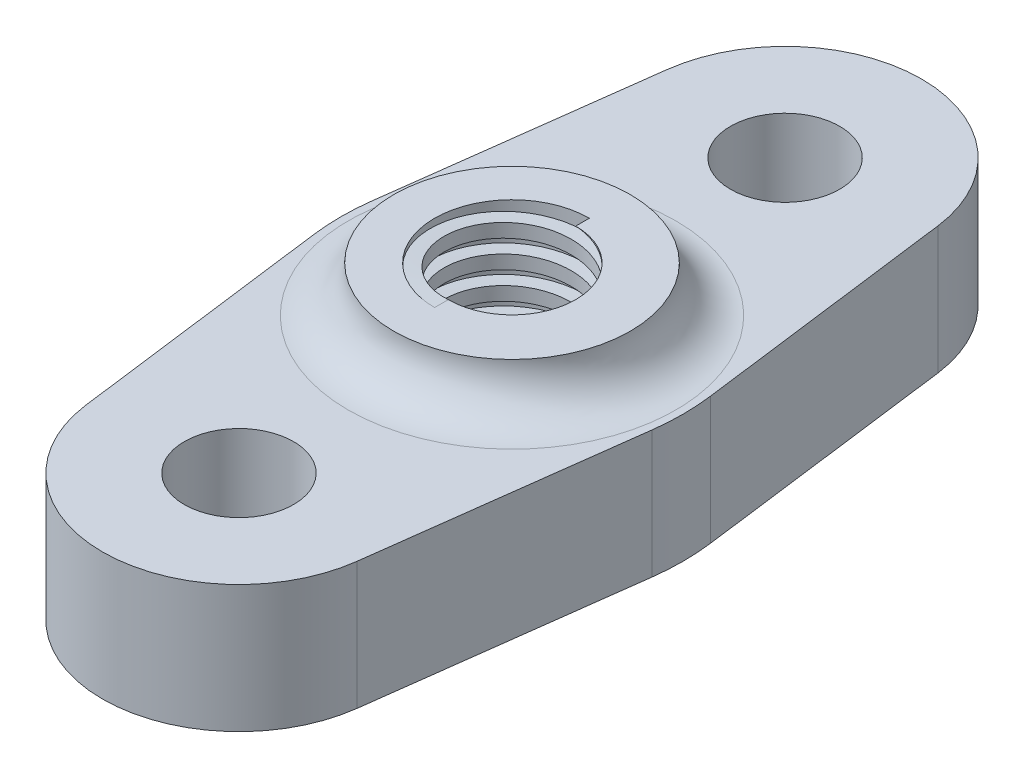
from build123d import *

# Parameters (mm, degrees)
CUT_EXTRUDE1_DEPTH      = 131.322676461
CUT_EXTRUDE1_DEPTH_BACK = 131.322676461
SKETCH2_R               = 12
FILLET1_R               = 50
CUT_SWEEP1_PITCH        = 6


with BuildPart() as part:
    # Sketch1 → Revolve1 (revolve)
    with BuildSketch(Plane(origin=(0, 0, 0), x_dir=(0, 0, -1), z_dir=(1, 0, 0)), mode=Mode.PRIVATE) as revolve1_sk:
        with BuildLine():
            Line((14, 0), (90, 0))
            Line((90, 0), (90, 28))
            Line((90, 28), (36, 28))
            ThreePointArc((36, 28), (28.928932188, 30.928932188), (26, 38))
            Line((26, 38), (14, 38))
            Line((14, 38), (14, 0))
        make_face()
    revolve(revolve1_sk.sketch.rotate(Axis((0, 32.058546587, 0), (0, -1, 0)), 180), axis=Axis((0, 32.058546587, 0), (0, -1, 0)))

    # Sketch2 → Cut-Extrude1 (cut, two sides: drawn at the far end of the back side and taken through both)
    with BuildSketch(Plane(origin=(0, 28, 0), x_dir=(1, 0, 0), z_dir=(0, 1, 0)).offset(-CUT_EXTRUDE1_DEPTH_BACK)):
        with BuildLine():
            ThreePointArc((90, 0), (63.639610267, 63.639610347), (-1.14e-07, 90))
            ThreePointArc((-1.14e-07, 90), (19.807790548, 82.531121446), (29.752782308, 63.843428795))
            Line((29.752782308, 63.843428795), (38, 0))
            Line((38, 0), (29.752782308, -63.843428795))
            ThreePointArc((29.752782308, -63.843428795), (19.807790681, -82.531121329), (2.41e-07, -90))
            ThreePointArc((2.41e-07, -90), (63.639610392, -63.639610222), (90, 0))
        make_face()
        with BuildLine():
            Line((-38, 0), (-29.752782308, 63.843428795))
            ThreePointArc((-29.752782308, 63.843428795), (-19.807790633, 82.531121371), (-1.14e-07, 90))
            ThreePointArc((-1.14e-07, 90), (-90, -1.77e-07), (2.41e-07, -90))
            ThreePointArc((2.41e-07, -90), (-19.8077905, -82.531121488), (-29.752782308, -63.843428795))
            Line((-29.752782308, -63.843428795), (-38, 0))
        make_face()
        with Locations(Location((0, -60, 0), (0, 0, 270))):
            Circle(SKETCH2_R)
        with Locations(Location((0, 60, 0), (0, 0, 270))):
            Circle(SKETCH2_R)
    extrude(amount=CUT_EXTRUDE1_DEPTH + CUT_EXTRUDE1_DEPTH_BACK, mode=Mode.SUBTRACT)

    # Fillet1
    fillet1_edges = [part.edges().sort_by_distance(p)[0] for p in [
        (38, 14, 0),
        (-38, 14, 0),
    ]]
    fillet(fillet1_edges, radius=FILLET1_R)

    # Cut-Sweep1: arcs per turn and ends read off the stored shape
    # Cut-Sweep1: the profile of Sketch4 profile screwed along a right-hand helix through 8.333333 turns, 14 arcs to a turn; built about Z, then put on its axis
    cut_sweep1_z = Axis((0, 0, 0), (0, 0, 1))
    cut_sweep1_corners = [(17, 0, -3), (13.9997, 0, -3), (13.9997, 0, 0), (17, 0, 0)]
    with BuildLine(mode=Mode.PRIVATE) as cut_sweep1_profile:
        Line(cut_sweep1_corners[0], cut_sweep1_corners[1])
        Line(cut_sweep1_corners[1], cut_sweep1_corners[2])
        Line(cut_sweep1_corners[2], cut_sweep1_corners[3])
        Line(cut_sweep1_corners[3], cut_sweep1_corners[0])
    cut_sweep1_cap = Face(cut_sweep1_profile.wire())
    cut_sweep1_turn_angles = [0, 12.857142857, 25.714285714, 38.571428571, 51.428571429, 64.285714286, 77.142857143, 90, 102.857142857, 115.714285714, 128.571428571, 141.428571429, 154.285714286, 167.142857143, 180, 192.857142857, 205.714285714, 218.571428571, 231.428571429, 244.285714286, 257.142857143, 270, 282.857142857, 295.714285714, 308.571428571, 321.428571429, 334.285714286, 347.142857143, 360]
    cut_sweep1_turn_weights = [1, 0.9749279121818236, 1, 0.9749279121818236, 1, 0.9749279121818236, 1, 0.9749279121818236, 1, 0.9749279121818236, 1, 0.9749279121818236, 1, 0.9749279121818236, 1, 0.9749279121818236, 1, 0.9749279121818236, 1, 0.9749279121818236, 1, 0.9749279121818236, 1, 0.9749279121818237, 1, 0.9749279121818236, 1, 0.9749279121818236, 1]
    cut_sweep1_turn_rails = [Edge.make_bspline([Vector(p[0], p[1], 0).rotate(cut_sweep1_z, cut_sweep1_turn_angles[k]) / cut_sweep1_turn_weights[k] + Vector(0, 0, p[2] + CUT_SWEEP1_PITCH * cut_sweep1_turn_angles[k] / 360) for k in range(29)], [0, 0, 0, 1, 1, 2, 2, 3, 3, 4, 4, 5, 5, 6, 6, 7, 7, 8, 8, 9, 9, 10, 10, 11, 11, 12, 12, 13, 13, 14, 14, 14], 2, cut_sweep1_turn_weights) for p in cut_sweep1_corners]
    cut_sweep1_turn_sides = [Face.make_surface_from_curves(cut_sweep1_turn_rails[p[0]], cut_sweep1_turn_rails[p[1]]) for p in [(0, 1), (1, 2), (2, 3), (3, 0)]]
    cut_sweep1_last_angles = [2880, 2892.857142857, 2905.714285714, 2918.571428571, 2931.428571429, 2944.285714286, 2957.142857143, 2970, 2982.857142857, 2991.428571429, 3000]
    cut_sweep1_last_weights = [1, 0.9749279121818235, 1, 0.9749279121818235, 1, 0.9749279121818235, 1, 0.9749279121818244, 1, 0.9888308262251247, 1]
    cut_sweep1_last_rails = [Edge.make_bspline([Vector(p[0], p[1], 0).rotate(cut_sweep1_z, cut_sweep1_last_angles[k]) / cut_sweep1_last_weights[k] + Vector(0, 0, p[2] + CUT_SWEEP1_PITCH * cut_sweep1_last_angles[k] / 360) for k in range(11)], [0, 0, 0, 1, 1, 2, 2, 3, 3, 4, 4, 5, 5, 5], 2, cut_sweep1_last_weights) for p in cut_sweep1_corners]
    cut_sweep1_last_sides = [Face.make_surface_from_curves(cut_sweep1_last_rails[p[0]], cut_sweep1_last_rails[p[1]]) for p in [(0, 1), (1, 2), (2, 3), (3, 0)]]
    cut_sweep1 = Plane(origin=(0, 38, 0), x_dir=(0, 0, 1), z_dir=(0, -1, 0)) * Solid(Shell([*[p.moved(Location((0, 0, CUT_SWEEP1_PITCH * i))) for i in range(8) for p in cut_sweep1_turn_sides], *cut_sweep1_last_sides, cut_sweep1_cap, cut_sweep1_cap.rotate(cut_sweep1_z, 3000).moved(Location((0, 0, CUT_SWEEP1_PITCH * 3000 / 360)))]))
    add(cut_sweep1, mode=Mode.SUBTRACT)


solid = part.part
